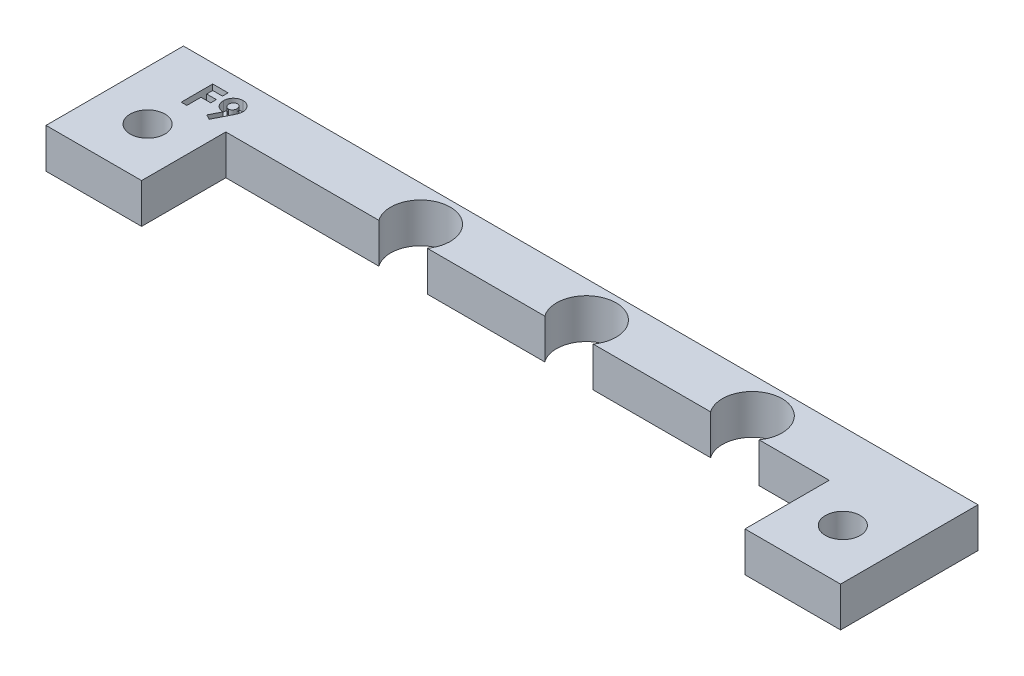
from build123d import *

# Parameters (mm, degrees)
BOSS_EXTRUDE1_OUTLINE_R = 1.75
BOSS_EXTRUDE1_DEPTH     = 4
CUT_EXTRUDE1_DEPTH      = 1


# Read off the part's stored shape, not the designer's step: Boss-Extrude1
with BuildPart() as part:
    # Boss-Extrude1 outline → Boss-Extrude1 (new body)
    with BuildSketch(Plane(origin=(0, 0, 0), x_dir=(1, 0, 0), z_dir=(0, 1, 0))):
        with BuildLine():
            Line((25.416474615, -10.33744254), (37.24307775, -10.33744254))
            ThreePointArc((37.24307775, -10.33744254), (39.679776182, -5.587442326), (42.116474615, -10.33744254))
            Line((42.116474615, -10.33744254), (49.179776182, -10.33744254))
            Line((49.179776182, -10.33744254), (49.179776182, -18.81631662))
            Line((49.179776182, -18.81631662), (58.804776182, -18.81631662))
            Line((58.804776182, -18.81631662), (58.804776182, -4.977921711))
            Line((58.804776182, -4.977921711), (-21.195223818, -4.977921711))
            Line((-21.195223818, -4.977921711), (-21.195223818, -18.81631662))
            Line((-21.195223818, -18.81631662), (-11.570223818, -18.81631662))
            Line((-11.570223818, -18.81631662), (-11.570223818, -10.33744254))
            Line((-11.570223818, -10.33744254), (3.84307775, -10.33744254))
            ThreePointArc((3.84307775, -10.33744254), (6.279776182, -5.587442326), (8.716474615, -10.33744254))
            Line((8.716474615, -10.33744254), (20.54307775, -10.33744254))
            ThreePointArc((20.54307775, -10.33744254), (22.979776182, -5.587442326), (25.416474615, -10.33744254))
        make_face()
        with Locations((-16.195223818, -13.587442433)):
            Circle(BOSS_EXTRUDE1_OUTLINE_R, mode=Mode.SUBTRACT)
        with Locations((53.804776182, -13.587442433)):
            Circle(BOSS_EXTRUDE1_OUTLINE_R, mode=Mode.SUBTRACT)
    extrude(amount=BOSS_EXTRUDE1_DEPTH)

    # Sketch2 → Cut-Extrude1 (cut)
    # profile 1 of 2: a face of its own
    with BuildSketch(Plane(origin=(0, 4, 0), x_dir=(1, 0, 0), z_dir=(0, 1, 0))):
        Polygon((-16.41198232, -6.812466594), (-14.865187448, -6.812466594), (-14.865187448, -7.382338389), (-15.842110525, -7.382338389), (-15.842110525, -7.992915312), (-14.865187448, -7.992915312), (-14.865187448, -8.562787107), (-15.842110525, -8.562787107), (-15.842110525, -9.987466594), (-16.41198232, -9.987466594), align=None)
    # profile 2 of 2: a face of its own
    with BuildSketch(Plane(origin=(0, 4, 0), x_dir=(1, 0, 0), z_dir=(0, 1, 0))):
        with BuildLine():
            Line((-13.509197865, -10.06887685), (-14.014195862, -9.814469799))
            Line((-14.014195862, -9.814469799), (-13.460860525, -8.725607619))
            add(Edge.make_bspline(
                [(-13.460860525, -8.725607619), (-13.493552847, -8.724774336), (-13.557735785, -8.723138398), (-13.652240154, -8.70954377), (-13.742612406, -8.686336872), (-13.829917734, -8.655442645), (-13.912948731, -8.614025733), (-13.992712215, -8.564596821), (-14.068103991, -8.505208694), (-14.139477538, -8.438453984), (-14.204643867, -8.364668422), (-14.261206862, -8.285313298), (-14.310508019, -8.20240162), (-14.348847302, -8.114061596), (-14.37964161, -8.021939666), (-14.402141484, -7.925558996), (-14.414767818, -7.82449673), (-14.416532622, -7.755714857), (-14.417431038, -7.720699767)],
                knots=[0, 0, 0, 0, 1.014336294, 1.991387562, 2.955278539, 3.906441712, 4.859855302, 5.829322156, 6.813833455, 7.833278715, 8.858926674, 9.863225732, 10.85404919, 11.846815163, 12.845559416, 13.865450493, 14.913355531, 16, 16, 16, 16], degree=3))
            add(Edge.make_bspline(
                [(-14.417431038, -7.720699767), (-14.416597708, -7.686735475), (-14.414955648, -7.619809541), (-14.40131818, -7.521584049), (-14.378874437, -7.427273226), (-14.348082426, -7.336893095), (-14.307090423, -7.251053103), (-14.259110328, -7.168409197), (-14.200456838, -7.09067119), (-14.134198348, -7.017502553), (-14.061681947, -6.950566169), (-13.984748133, -6.89171273), (-13.903746713, -6.84251691), (-13.819718635, -6.801201496), (-13.73114503, -6.77033319), (-13.639305886, -6.747043281), (-13.543517063, -6.733601675), (-13.478497608, -6.731911573), (-13.445596102, -6.731056337)],
                knots=[0, 0, 0, 0, 1.055538678, 2.079917126, 3.075849687, 4.065898488, 5.041806164, 6.028602842, 7.031727914, 8.062953097, 9.093756959, 10.095582084, 11.068815425, 12.035667573, 13.000833448, 13.979119574, 14.977382875, 16, 16, 16, 16], degree=3))
            add(Edge.make_bspline(
                [(-13.445596102, -6.731056337), (-13.411193598, -6.731764476), (-13.343545729, -6.733156934), (-13.244518332, -6.748522162), (-13.149772928, -6.772095231), (-13.058924549, -6.804112269), (-12.97310104, -6.847566016), (-12.891584275, -6.899645635), (-12.814645404, -6.96150342), (-12.743110693, -7.03135644), (-12.678050673, -7.107334669), (-12.620383061, -7.186865545), (-12.571939818, -7.269793563), (-12.532261839, -7.355378619), (-12.501352894, -7.443754793), (-12.480106932, -7.535047442), (-12.466001971, -7.629100452), (-12.464397107, -7.692875343), (-12.463584884, -7.72515189)],
                knots=[0, 0, 0, 0, 1.062826075, 2.08990367, 3.089830715, 4.078784409, 5.060762809, 6.057138927, 7.064407536, 8.107320944, 9.143871033, 10.153461498, 11.140480137, 12.108246174, 13.065926856, 14.029354859, 15.002654194, 16, 16, 16, 16], degree=3))
            add(Edge.make_bspline(
                [(-12.463584884, -7.72515189), (-12.464028122, -7.749768446), (-12.464920902, -7.799351725), (-12.473699398, -7.873707226), (-12.487018143, -7.94826881), (-12.502477367, -8.01095661), (-12.518684213, -8.063798617), (-12.534455319, -8.108625261), (-12.554690113, -8.158391252), (-12.577284282, -8.213430161), (-12.60345099, -8.273500634), (-12.633732754, -8.338315513), (-12.666299428, -8.408836066), (-12.690304282, -8.45705706), (-12.702727513, -8.482012868)],
                knots=[0, 0, 0, 0, 1.105131805, 2.225983929, 3.357782449, 4.505488967, 5.122909461, 5.839607681, 6.638776516, 7.535249922, 8.51168636, 9.581005249, 10.748097757, 12, 12, 12, 12], degree=3))
            Line((-12.702727513, -8.482012868), (-13.509197865, -10.06887685))
        make_face()
        with BuildLine():
            add(Edge.make_bspline(
                [(-13.43287575, -8.196440953), (-13.405569868, -8.194833376), (-13.352220356, -8.191692536), (-13.275587332, -8.16740689), (-13.207004671, -8.125847553), (-13.146217368, -8.07063542), (-13.095984603, -8.003274093), (-13.059462095, -7.92658921), (-13.036965354, -7.84216883), (-13.034648703, -7.783384123), (-13.033456679, -7.753136666)],
                knots=[0, 0, 0, 0, 0.984774978, 1.924027336, 2.867853169, 3.859505234, 4.871392407, 5.881338128, 6.909850265, 8, 8, 8, 8], degree=3))
            add(Edge.make_bspline(
                [(-13.033456679, -7.753136666), (-13.034892342, -7.722259992), (-13.03768505, -7.66219749), (-13.0603973, -7.575750698), (-13.099207968, -7.497607925), (-13.152007661, -7.429680335), (-13.213650613, -7.37283362), (-13.282582994, -7.331308626), (-13.357130982, -7.305630901), (-13.408720798, -7.302506546), (-13.434783803, -7.300928132)],
                knots=[0, 0, 0, 0, 1.104110315, 2.147758178, 3.172670271, 4.206310416, 5.210906102, 6.157051016, 7.068948237, 8, 8, 8, 8], degree=3))
            add(Edge.make_bspline(
                [(-13.434783803, -7.300928132), (-13.462330936, -7.302466882), (-13.516419507, -7.305488204), (-13.594004346, -7.331104267), (-13.665525389, -7.371831843), (-13.72798309, -7.428871436), (-13.782037835, -7.495904441), (-13.819731685, -7.574310981), (-13.843578121, -7.660154514), (-13.846208342, -7.720324727), (-13.847559243, -7.751228613)],
                knots=[0, 0, 0, 0, 0.970967322, 1.90648639, 2.855811969, 3.858352357, 4.877096915, 5.878517833, 6.91039038, 8, 8, 8, 8], degree=3))
            add(Edge.make_bspline(
                [(-13.847559243, -7.751228613), (-13.846148143, -7.781691987), (-13.8434037, -7.840940069), (-13.820402477, -7.92583923), (-13.782935789, -8.002929935), (-13.731716155, -8.070822503), (-13.668626178, -8.126306671), (-13.596992367, -8.167423317), (-13.517086507, -8.191758387), (-13.461451298, -8.194852), (-13.43287575, -8.196440953)],
                knots=[0, 0, 0, 0, 1.075706617, 2.092137047, 3.084482865, 4.090466434, 5.0784141, 6.035155512, 6.990809768, 8, 8, 8, 8], degree=3))
        make_face(mode=Mode.SUBTRACT)
    extrude(amount=-CUT_EXTRUDE1_DEPTH, mode=Mode.SUBTRACT)


solid = part.part
